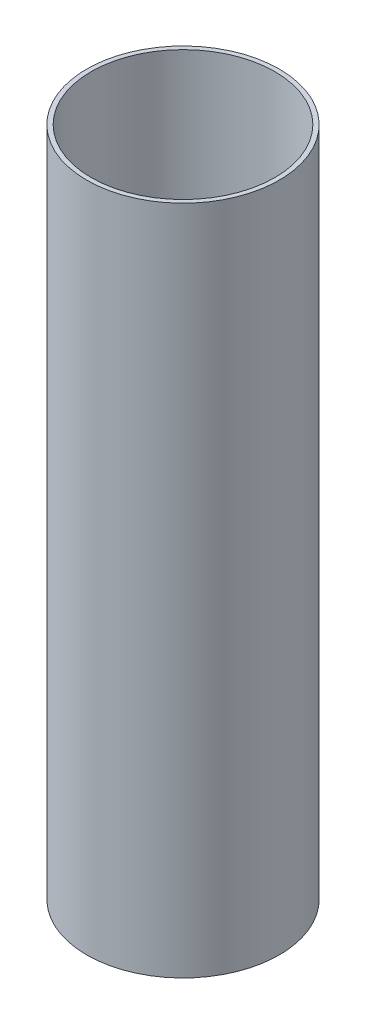
from build123d import *

# Parameters (mm, degrees)
SZKIC1_W = 3
SZKIC1_H = 453


with BuildPart() as part:
    # Szkic1 → Obrót1 (revolve)
    with BuildSketch(Plane.XY):
        with Locations((63.5, 0)):
            Rectangle(SZKIC1_W, SZKIC1_H)
    revolve(axis=Axis((0, 150, 0), (0, -1, 0)))


solid = part.part
